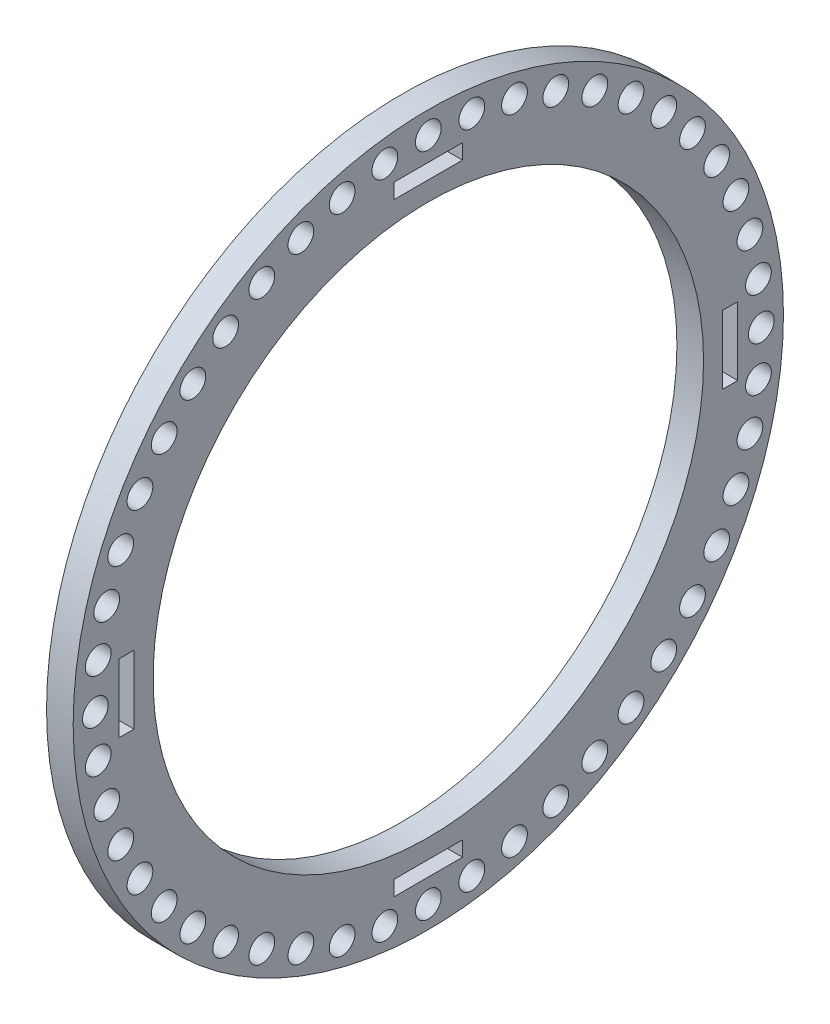
from build123d import *

# Parameters (mm, degrees)
SKETCH1_R           = 40
SKETCH1_R_2         = 31
SKETCH1_W           = 7.7
SKETCH1_H           = 1.7
SKETCH1_W_2         = 1.7
SKETCH1_H_2         = 7.7
BOSS_EXTRUDE4_DEPTH = 3
CUT_EXTRUDE2_REACH  = 58.648
SKETCH2_R           = 1.45
CIRPATTERN3_COUNT   = 48


with BuildPart() as part:
    # Sketch1 → Boss-Extrude4 (new body)
    with BuildSketch(Plane(origin=(0, 0, 0), x_dir=(0, 0, -1), z_dir=(1, 0, 0))):
        Circle(SKETCH1_R)
        Circle(SKETCH1_R_2, mode=Mode.SUBTRACT)
        with Locations((0, 34)):
            Rectangle(SKETCH1_W, SKETCH1_H, mode=Mode.SUBTRACT)
        with Locations((34, 0)):
            Rectangle(SKETCH1_W_2, SKETCH1_H_2, mode=Mode.SUBTRACT)
        with Locations((0, -34)):
            Rectangle(SKETCH1_W, SKETCH1_H, mode=Mode.SUBTRACT)
        with Locations((-34, 0)):
            Rectangle(SKETCH1_W_2, SKETCH1_H_2, mode=Mode.SUBTRACT)
    extrude(amount=BOSS_EXTRUDE4_DEPTH)

    # Sketch2 → Cut-Extrude2 (cut, up to next)
    with BuildSketch(Plane(origin=(3, 0, 0), x_dir=(0, 0, -1), z_dir=(1, 0, 0)), mode=Mode.PRIVATE) as cut_extrude2_sk1:
        with Locations((0, 37.5)):
            Circle(SKETCH2_R)
    cut_extrude2_tool1 = extrude(cut_extrude2_sk1.sketch, amount=-CUT_EXTRUDE2_REACH, mode=Mode.PRIVATE) & part.part
    cut_extrude2 = cut_extrude2_tool1.solids().sort_by_distance((3, 37.5, 0))[0]
    add(cut_extrude2, mode=Mode.SUBTRACT)

    # CirPattern3: Cut-Extrude2 ×48 about axis
    cirpattern3_axis = Axis((3, 0, 0), (1, 0, 0))
    for i in range(1, CIRPATTERN3_COUNT):
        add(cut_extrude2.rotate(cirpattern3_axis, i * 360 / CIRPATTERN3_COUNT), mode=Mode.SUBTRACT)


solid = part.part
